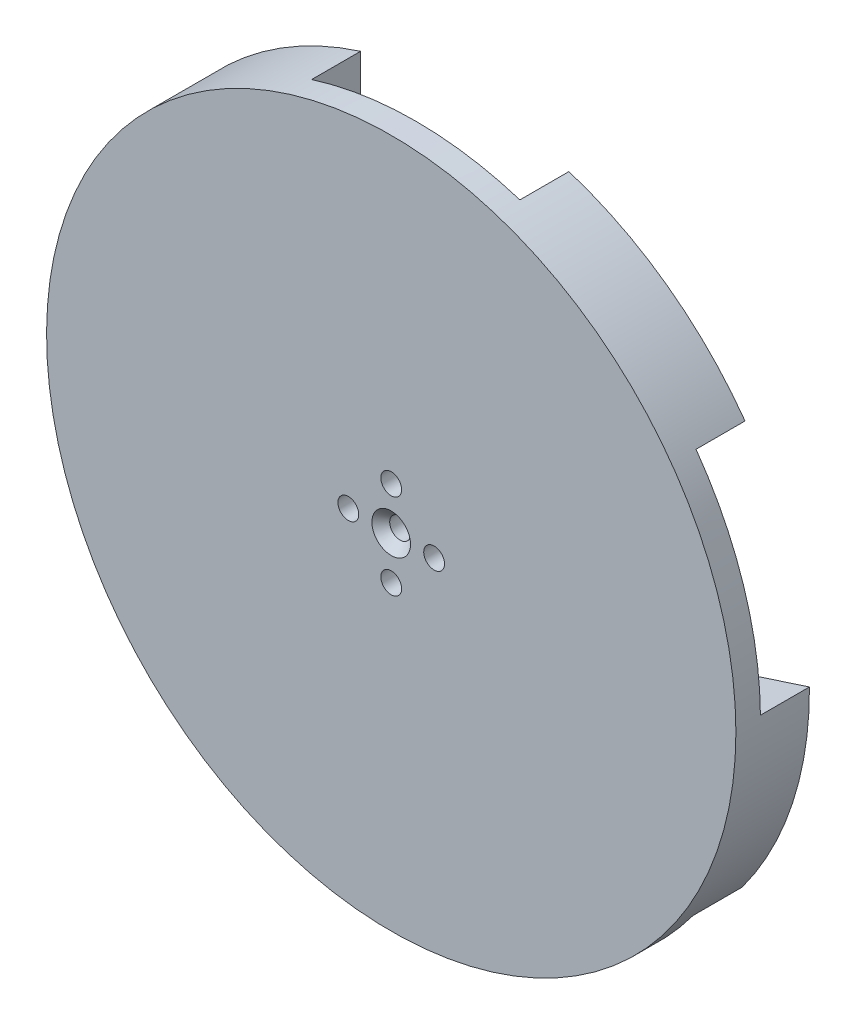
from build123d import *

# Parameters (mm, degrees)
SKETCH2_R                                       = 56.25
BOSS_EXTRUDE1_DEPTH                             = 12
SKETCH4_R                                       = 10
CUT_EXTRUDE2_DEPTH                              = 2
M3_CLEARANCE_HOLE1_D                            = 3.4
M3_CLEARANCE_HOLE1_DEPTH                        = 10
M3_CLEARANCE_HOLE1_TIP                          = 1.021463052
CSK_FOR_M3_FLAT_HEAD_MACHINE_SCREW2_D           = 3.4
CSK_FOR_M3_FLAT_HEAD_MACHINE_SCREW2_DEPTH       = 10
CSK_FOR_M3_FLAT_HEAD_MACHINE_SCREW2_CSINK_D     = 6.3
CSK_FOR_M3_FLAT_HEAD_MACHINE_SCREW2_CSINK_ANGLE = 90
CSK_FOR_M3_FLAT_HEAD_MACHINE_SCREW2_TIP         = 1.021463052
CUT_EXTRUDE3_DEPTH                              = 8
CIRPATTERN1_COUNT                               = 5
SKETCH11_R                                      = 5.25
CUT_EXTRUDE4_DEPTH                              = 2.5


with BuildPart() as part:
    # Sketch2 → Boss-Extrude1 (new body)
    with BuildSketch(Plane.XY):
        Circle(SKETCH2_R)
    extrude(amount=BOSS_EXTRUDE1_DEPTH)

    # Sketch4 → Cut-Extrude2 (cut)
    with BuildSketch(Plane(origin=(0, 0, 0), x_dir=(-1, 0, 0), z_dir=(0, 0, -1))):
        Circle(SKETCH4_R)
    extrude(amount=-CUT_EXTRUDE2_DEPTH, mode=Mode.SUBTRACT)

    # M3 Clearance Hole1
    with Locations(Plane(origin=(0, 0, 2), x_dir=(-1, 0, 0), z_dir=(0, 0, -1))):
        with Locations((7, 0), (0, 7), (-7, 0), (0, -7)):
            Hole(M3_CLEARANCE_HOLE1_D / 2, depth=M3_CLEARANCE_HOLE1_DEPTH)
            with Locations((0, 0, -(M3_CLEARANCE_HOLE1_DEPTH + M3_CLEARANCE_HOLE1_TIP / 2))):  # 118° drill point
                Cone(0, M3_CLEARANCE_HOLE1_D / 2, M3_CLEARANCE_HOLE1_TIP, mode=Mode.SUBTRACT)

    # CSK for M3 Flat Head Machine Screw2
    with Locations(Plane.XY.offset(12)):
        with Locations((0, 0)):
            CounterSinkHole(CSK_FOR_M3_FLAT_HEAD_MACHINE_SCREW2_D / 2, CSK_FOR_M3_FLAT_HEAD_MACHINE_SCREW2_CSINK_D / 2, depth=CSK_FOR_M3_FLAT_HEAD_MACHINE_SCREW2_DEPTH, counter_sink_angle=CSK_FOR_M3_FLAT_HEAD_MACHINE_SCREW2_CSINK_ANGLE)
            with Locations((0, 0, -(CSK_FOR_M3_FLAT_HEAD_MACHINE_SCREW2_DEPTH + CSK_FOR_M3_FLAT_HEAD_MACHINE_SCREW2_TIP / 2))):  # 118° drill point
                Cone(0, CSK_FOR_M3_FLAT_HEAD_MACHINE_SCREW2_D / 2, CSK_FOR_M3_FLAT_HEAD_MACHINE_SCREW2_TIP, mode=Mode.SUBTRACT)

    # Sketch3 → Cut-Extrude3 (cut)
    with BuildSketch(Plane(origin=(0, 0, 0), x_dir=(-1, 0, 0), z_dir=(0, 0, -1))):
        with BuildLine():
            Line((-17, 34.65), (-17, 53.619609286))
            ThreePointArc((-17, 53.619609286), (0, 56.25), (17, 53.619609286))
            Line((17, 53.619609286), (17, 34.65))
            ThreePointArc((17, 34.65), (0, 17.65), (-17, 34.65))
        make_face()
    cut_extrude3 = extrude(amount=-CUT_EXTRUDE3_DEPTH, mode=Mode.SUBTRACT)

    # CirPattern1: Cut-Extrude3 ×5 about axis
    cirpattern1_axis = Axis((0, 0, 12), (0, 0, -1))
    for i in range(1, CIRPATTERN1_COUNT):
        add(cut_extrude3.rotate(cirpattern1_axis, i * 360 / CIRPATTERN1_COUNT), mode=Mode.SUBTRACT)

    # Sketch11 → Cut-Extrude4 (cut)
    with BuildSketch(Plane(origin=(0, 0, 8), x_dir=(-1, 0, 0), z_dir=(0, 0, -1))):
        with Locations((0, 34.65)):
            Circle(SKETCH11_R)
    extrude(amount=-CUT_EXTRUDE4_DEPTH, mode=Mode.SUBTRACT)


solid = part.part
